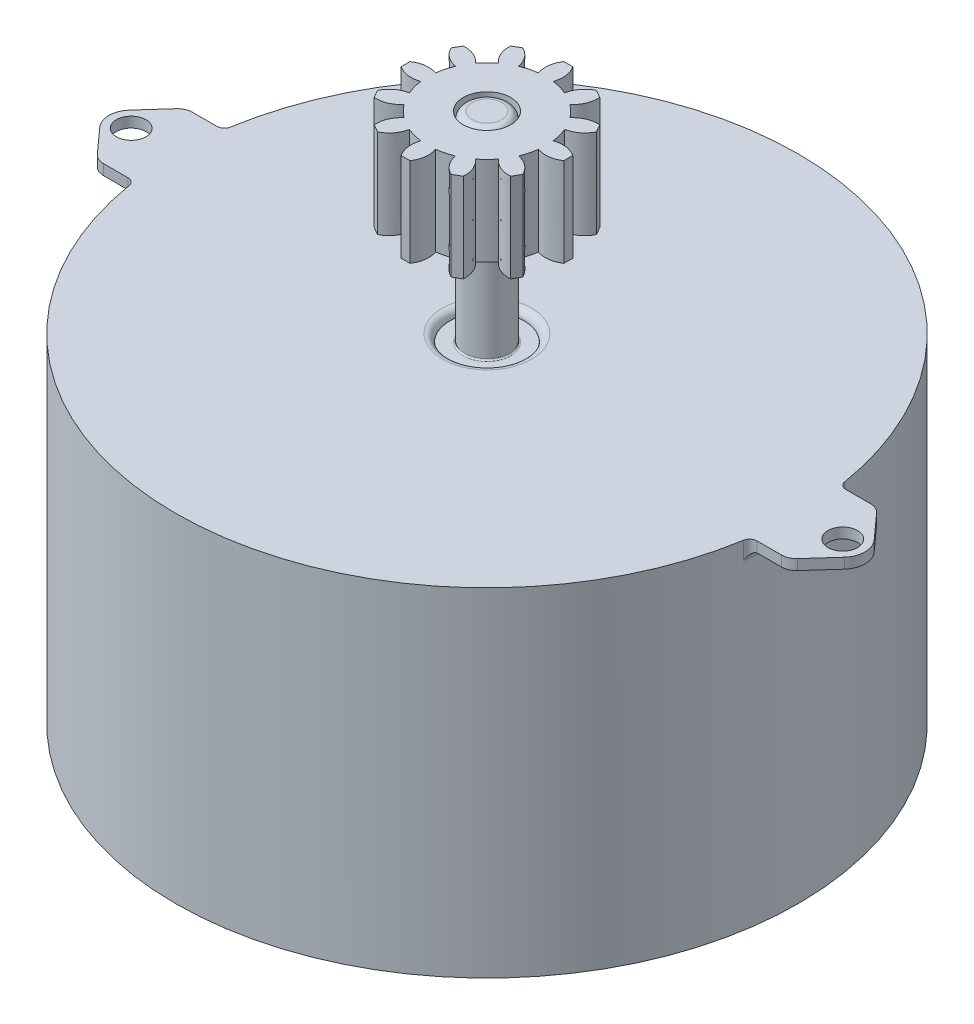
from build123d import *

# Parameters (mm, degrees)
SKETCH1_R           = 21
BOSS_EXTRUDE1_DEPTH = 22.8
SKETCH2_R           = 1.5
BOSS_EXTRUDE2_DEPTH = 13
CUT_EXTRUDE1_START  = -0.5
SKETCH3_R           = 2.5
SKETCH3_R_2         = 1.5
CUT_EXTRUDE1_DEPTH  = 0.5
FILLET1_R           = 0.1
FILLET2_R           = 0.5
FILLET3_R           = 0.5
BOSS_EXTRUDE3_START = -0.7
SKETCH4_R           = 1
BOSS_EXTRUDE3_DEPTH = 0.7
FILLET4_R           = 0.5
SKETCH7_R           = 1.6
BOSS_EXTRUDE5_DEPTH = 6


with BuildPart() as part:
    # Sketch1 → Boss-Extrude1 (new body)
    with BuildSketch(Plane(origin=(0, 0, 0), x_dir=(1, 0, 0), z_dir=(0, 1, 0))):
        with Locations(Location((0, 0, 0), (0, 0, 270))):
            Circle(SKETCH1_R)
    extrude(amount=BOSS_EXTRUDE1_DEPTH)

    # Sketch2 → Boss-Extrude2 (add)
    with BuildSketch(Plane(origin=(0, 22.8, 0), x_dir=(1, 0, 0), z_dir=(0, 1, 0))):
        with Locations(Location((0, 0, 0), (0, 0, 90))):
            Circle(SKETCH2_R)
    extrude(amount=BOSS_EXTRUDE2_DEPTH)

    # Sketch3 → Cut-Extrude1 (cut)
    with BuildSketch(Plane(origin=(0, 22.8, 0), x_dir=(1, 0, 0), z_dir=(0, 1, 0)).offset(CUT_EXTRUDE1_START)):
        with Locations(Location((0, 0, 0), (0, 0, 270))):
            Circle(SKETCH3_R)
        with Locations(Location((0, 0, 0), (0, 0, 90))):
            Circle(SKETCH3_R_2, mode=Mode.SUBTRACT)
    extrude(amount=CUT_EXTRUDE1_DEPTH, mode=Mode.SUBTRACT)

    # Fillet1
    fillet1_edges = [part.edges().sort_by_distance(p)[0] for p in [
        (0, 22.3, 1.5),
    ]]
    fillet(fillet1_edges, radius=FILLET1_R)

    # Fillet2
    fillet2_edges = [part.edges().sort_by_distance(p)[0] for p in [
        (0, 22.8, -2.5),
    ]]
    fillet(fillet2_edges, radius=FILLET2_R - 0.0001)  # a hair under: the kernel refuses the full size

    # Fillet3
    fillet3_edges = [part.edges().sort_by_distance(p)[0] for p in [
        (0, 35.8, 1.5),
    ]]
    fillet(fillet3_edges, radius=FILLET3_R)

    # Sketch4 → Boss-Extrude3 (add)
    # profile 1 of 2: a face of its own
    with BuildSketch(Plane(origin=(0, 22.8, 0), x_dir=(1, 0, 0), z_dir=(0, 1, 0)).offset(BOSS_EXTRUDE3_START)):
        with BuildLine():
            Line((-25.114717238, 1.00369591), (-23.615153102, 2.669130606))
            ThreePointArc((-23.615153102, 2.669130606), (-23.278744919, 2.913545458), (-22.872008276, 3))
            Line((-22.872008276, 3), (-20.784609691, 3))
            ThreePointArc((-20.784609691, 3), (-21, 0), (-20.784609691, -3))
            Line((-20.784609691, -3), (-22.872008276, -3))
            ThreePointArc((-22.872008276, -3), (-23.278744919, -2.913545458), (-23.615153102, -2.669130606))
            Line((-23.615153102, -2.669130606), (-25.114717238, -1.00369591))
            ThreePointArc((-25.114717238, -1.00369591), (-25.5, 0), (-25.114717238, 1.00369591))
        make_face()
        with Locations(Location((-24, 0, 0), (0, 0, 270))):
            Circle(SKETCH4_R, mode=Mode.SUBTRACT)
    # profile 2 of 2: a face of its own
    with BuildSketch(Plane(origin=(0, 22.8, 0), x_dir=(1, 0, 0), z_dir=(0, 1, 0)).offset(BOSS_EXTRUDE3_START)):
        with BuildLine():
            Line((25.114717238, -1.00369591), (23.615153102, -2.669130606))
            ThreePointArc((23.615153102, -2.669130606), (23.278744919, -2.913545458), (22.872008276, -3))
            Line((22.872008276, -3), (20.784609691, -3))
            ThreePointArc((20.784609691, -3), (21, 0), (20.784609691, 3))
            Line((20.784609691, 3), (22.872008276, 3))
            ThreePointArc((22.872008276, 3), (23.278744919, 2.913545458), (23.615153102, 2.669130606))
            Line((23.615153102, 2.669130606), (25.114717238, 1.00369591))
            ThreePointArc((25.114717238, 1.00369591), (25.5, 0), (25.114717238, -1.00369591))
        make_face()
        with Locations(Location((24, 0, 0), (0, 0, 90))):
            Circle(SKETCH4_R, mode=Mode.SUBTRACT)
    extrude(amount=BOSS_EXTRUDE3_DEPTH)

    # Fillet4
    fillet4_edges = [part.edges().sort_by_distance(p)[0] for p in [
        (-21, 22.1, 0),
        (-20.784609691, 22.45, -3),
        (-20.784609691, 22.45, 3),
        (21, 22.1, 0),
        (20.784609691, 22.45, 3),
        (20.784609691, 22.45, -3),
    ]]
    fillet(fillet4_edges, radius=FILLET4_R)


with BuildPart() as body_2:
    # Sketch7 → Boss-Extrude5 (new body)
    with BuildSketch(Plane(origin=(0, 35.8, 0), x_dir=(1, 0, 0), z_dir=(0, 1, 0))):
        with BuildLine():
            Line((-0.3, 5.489077784), (0.3, 5.489077784))
            add(Edge.make_bspline(
                [(0.3, 5.489077784), (0.760195198, 4.792070296), (0.5, 3.966048998)],
                knots=[0, 0, 0, 1, 1, 1], degree=2))
            ThreePointArc((0.5, 3.966048998), (1.03461419, 3.861232722), (1.550011797, 3.684699185))
            add(Edge.make_bspline(
                [(2.484731271, 4.903680804), (1.737686795, 4.530152212), (1.550011797, 3.684699185)],
                knots=[0, 0, 0, 1, 1, 1], degree=2))
            Line((2.484731271, 4.903680804), (3.004346513, 4.603680804))
            add(Edge.make_bspline(
                [(3.004346513, 4.603680804), (3.054383501, 3.769957014), (2.416037201, 3.184699185)],
                knots=[0, 0, 0, 1, 1, 1], degree=2))
            ThreePointArc((2.416037201, 3.184699185), (2.826618532, 2.826618532), (3.184699185, 2.416037201))
            add(Edge.make_bspline(
                [(4.603680804, 3.004346513), (3.769957014, 3.054383501), (3.184699185, 2.416037201)],
                knots=[0, 0, 0, 1, 1, 1], degree=2))
            Line((4.603680804, 3.004346513), (4.903680804, 2.484731271))
            add(Edge.make_bspline(
                [(4.903680804, 2.484731271), (4.530152212, 1.737686795), (3.684699185, 1.550011797)],
                knots=[0, 0, 0, 1, 1, 1], degree=2))
            ThreePointArc((3.684699185, 1.550011797), (3.861232722, 1.03461419), (3.966048998, 0.5))
            add(Edge.make_bspline(
                [(5.489077784, 0.3), (4.792070296, 0.760195198), (3.966048998, 0.5)],
                knots=[0, 0, 0, 1, 1, 1], degree=2))
            Line((5.489077784, 0.3), (5.489077784, -0.3))
            add(Edge.make_bspline(
                [(5.489077784, -0.3), (4.792070296, -0.760195198), (3.966048998, -0.5)],
                knots=[0, 0, 0, 1, 1, 1], degree=2))
            ThreePointArc((3.966048998, -0.5), (3.861232722, -1.03461419), (3.684699185, -1.550011797))
            add(Edge.make_bspline(
                [(4.903680804, -2.484731271), (4.530152212, -1.737686795), (3.684699185, -1.550011797)],
                knots=[0, 0, 0, 1, 1, 1], degree=2))
            Line((4.903680804, -2.484731271), (4.603680804, -3.004346513))
            add(Edge.make_bspline(
                [(4.603680804, -3.004346513), (3.769957014, -3.054383501), (3.184699185, -2.416037201)],
                knots=[0, 0, 0, 1, 1, 1], degree=2))
            ThreePointArc((3.184699185, -2.416037201), (2.826618532, -2.826618532), (2.416037201, -3.184699185))
            add(Edge.make_bspline(
                [(3.004346513, -4.603680804), (3.054383501, -3.769957014), (2.416037201, -3.184699185)],
                knots=[0, 0, 0, 1, 1, 1], degree=2))
            Line((3.004346513, -4.603680804), (2.484731271, -4.903680804))
            add(Edge.make_bspline(
                [(2.484731271, -4.903680804), (1.737686795, -4.530152212), (1.550011797, -3.684699185)],
                knots=[0, 0, 0, 1, 1, 1], degree=2))
            ThreePointArc((1.550011797, -3.684699185), (1.03461419, -3.861232722), (0.5, -3.966048998))
            add(Edge.make_bspline(
                [(0.3, -5.489077784), (0.760195198, -4.792070296), (0.5, -3.966048998)],
                knots=[0, 0, 0, 1, 1, 1], degree=2))
            Line((0.3, -5.489077784), (-0.3, -5.489077784))
            add(Edge.make_bspline(
                [(-0.3, -5.489077784), (-0.760195198, -4.792070296), (-0.5, -3.966048998)],
                knots=[0, 0, 0, 1, 1, 1], degree=2))
            ThreePointArc((-0.5, -3.966048998), (-1.03461419, -3.861232722), (-1.550011797, -3.684699185))
            add(Edge.make_bspline(
                [(-2.484731271, -4.903680804), (-1.737686795, -4.530152212), (-1.550011797, -3.684699185)],
                knots=[0, 0, 0, 1, 1, 1], degree=2))
            Line((-2.484731271, -4.903680804), (-3.004346513, -4.603680804))
            add(Edge.make_bspline(
                [(-3.004346513, -4.603680804), (-3.054383501, -3.769957014), (-2.416037201, -3.184699185)],
                knots=[0, 0, 0, 1, 1, 1], degree=2))
            ThreePointArc((-2.416037201, -3.184699185), (-2.826618532, -2.826618532), (-3.184699185, -2.416037201))
            add(Edge.make_bspline(
                [(-4.603680804, -3.004346513), (-3.769957014, -3.054383501), (-3.184699185, -2.416037201)],
                knots=[0, 0, 0, 1, 1, 1], degree=2))
            Line((-4.603680804, -3.004346513), (-4.903680804, -2.484731271))
            add(Edge.make_bspline(
                [(-4.903680804, -2.484731271), (-4.530152212, -1.737686795), (-3.684699185, -1.550011797)],
                knots=[0, 0, 0, 1, 1, 1], degree=2))
            ThreePointArc((-3.684699185, -1.550011797), (-3.861232722, -1.03461419), (-3.966048998, -0.5))
            add(Edge.make_bspline(
                [(-5.489077784, -0.3), (-4.792070296, -0.760195198), (-3.966048998, -0.5)],
                knots=[0, 0, 0, 1, 1, 1], degree=2))
            Line((-5.489077784, -0.3), (-5.489077784, 0.3))
            add(Edge.make_bspline(
                [(-5.489077784, 0.3), (-4.792070296, 0.760195198), (-3.966048998, 0.5)],
                knots=[0, 0, 0, 1, 1, 1], degree=2))
            ThreePointArc((-3.966048998, 0.5), (-3.861232722, 1.03461419), (-3.684699185, 1.550011797))
            add(Edge.make_bspline(
                [(-4.903680804, 2.484731271), (-4.530152212, 1.737686795), (-3.684699185, 1.550011797)],
                knots=[0, 0, 0, 1, 1, 1], degree=2))
            Line((-4.903680804, 2.484731271), (-4.603680804, 3.004346513))
            add(Edge.make_bspline(
                [(-4.603680804, 3.004346513), (-3.769957014, 3.054383501), (-3.184699185, 2.416037201)],
                knots=[0, 0, 0, 1, 1, 1], degree=2))
            ThreePointArc((-3.184699185, 2.416037201), (-2.826618532, 2.826618532), (-2.416037201, 3.184699185))
            add(Edge.make_bspline(
                [(-3.004346513, 4.603680804), (-3.054383501, 3.769957014), (-2.416037201, 3.184699185)],
                knots=[0, 0, 0, 1, 1, 1], degree=2))
            Line((-3.004346513, 4.603680804), (-2.484731271, 4.903680804))
            add(Edge.make_bspline(
                [(-2.484731271, 4.903680804), (-1.737686795, 4.530152212), (-1.550011797, 3.684699185)],
                knots=[0, 0, 0, 1, 1, 1], degree=2))
            ThreePointArc((-1.550011797, 3.684699185), (-1.03461419, 3.861232722), (-0.5, 3.966048998))
            add(Edge.make_bspline(
                [(-0.3, 5.489077784), (-0.760195198, 4.792070296), (-0.5, 3.966048998)],
                knots=[0, 0, 0, 1, 1, 1], degree=2))
        make_face()
        with Locations(Location((0, 0, 0), (0, 0, 270))):
            Circle(SKETCH7_R, mode=Mode.SUBTRACT)
    extrude(amount=-BOSS_EXTRUDE5_DEPTH)


solid = Compound([part.part, body_2.part])
